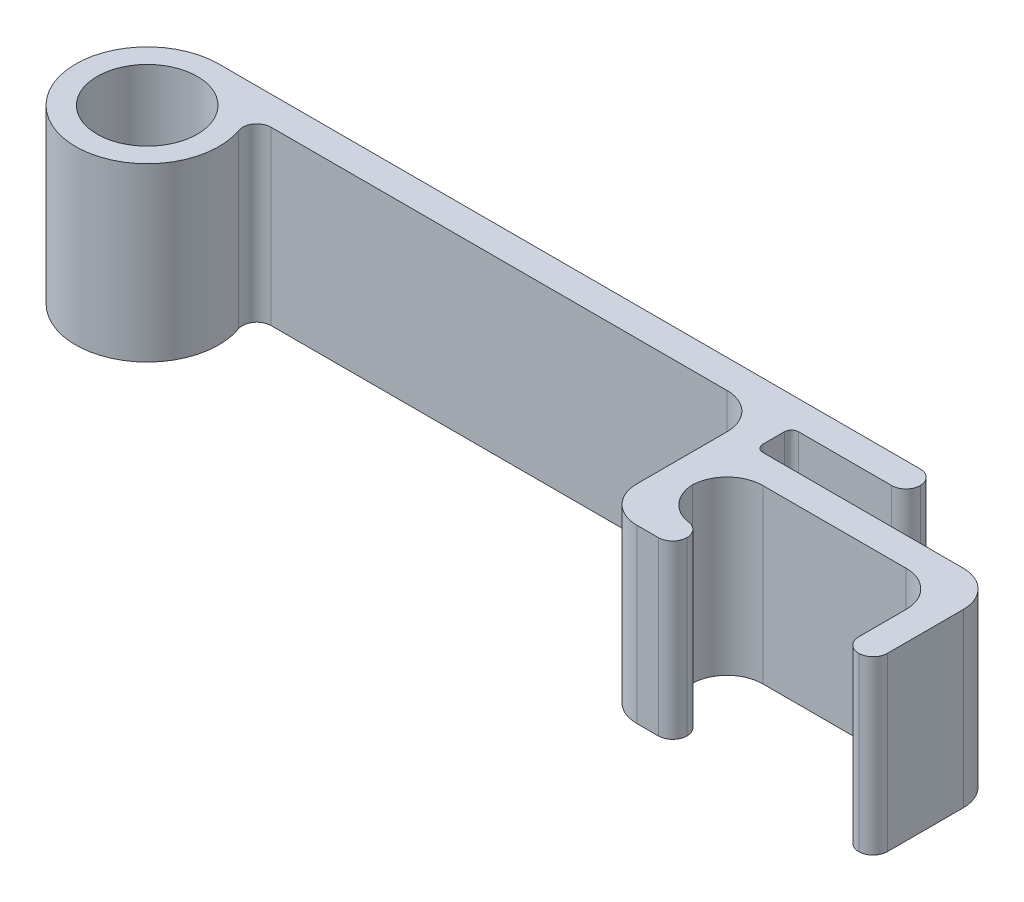
from build123d import *

# Parameters (mm, degrees)
SKETCH1_R           = 5
BOSS_EXTRUDE1_DEPTH = 12
SKETCH2_R           = 3.5
CUT_EXTRUDE1_DEPTH  = 14.928388277
BOSS_EXTRUDE2_START = -12
BOSS_EXTRUDE2_DEPTH = 12
BOSS_EXTRUDE3_DEPTH = 12
BOSS_EXTRUDE4_DEPTH = 12
FILLET1_R           = 1
FILLET2_R           = 2.5
FILLET3_R           = 2.5
FILLET4_R           = 1
FILLET5_R           = 0.5
SKETCH7_W           = 0.628205129
SKETCH7_H           = 3.58974359
CUT_EXTRUDE2_DEPTH  = 0.5


# Some blends are built 0.0001 mm under size
with BuildPart() as part:
    # Sketch1 → Boss-Extrude1 (new body)
    with BuildSketch(Plane(origin=(0, 0, 0), x_dir=(1, 0, 0), z_dir=(0, 1, 0))):
        with Locations(Location((0, 0, 0), (0, 0, 270))):
            Circle(SKETCH1_R)
    extrude(amount=BOSS_EXTRUDE1_DEPTH)

    # Sketch2 → Cut-Extrude1 (cut, through all)
    with BuildSketch(Plane(origin=(0, 12, 0), x_dir=(1, 0, 0), z_dir=(0, 1, 0))):
        with Locations(Location((0, 0, 0), (0, 0, 270))):
            Circle(SKETCH2_R)
    extrude(amount=-CUT_EXTRUDE1_DEPTH, mode=Mode.SUBTRACT)

    # Sketch3 → Boss-Extrude2 (add)
    with BuildSketch(Plane(origin=(0, 12, 0), x_dir=(1, 0, 0), z_dir=(0, 1, 0)).offset(BOSS_EXTRUDE2_START)):
        with BuildLine():
            Line((0, 5), (50, 5))
            Line((50, 5), (50, 3))
            Line((50, 3), (4, 3))
            ThreePointArc((4, 3), (2.236067977, 4.472135955), (0, 5))
        make_face()
    extrude(amount=BOSS_EXTRUDE2_DEPTH)

    # Sketch4 → Boss-Extrude3 (add)
    with BuildSketch(Plane(origin=(0, 12, 0), x_dir=(1, 0, 0), z_dir=(0, 1, 0))):
        Polygon((40, 3), (40, -8.3), (45, -8.3), (45, -6.3), (42, -6.3), (42, 3), align=None)
    extrude(amount=-BOSS_EXTRUDE3_DEPTH)

    # Sketch6 → Boss-Extrude4 (add)
    with BuildSketch(Plane(origin=(0, 12, 0), x_dir=(1, 0, 0), z_dir=(0, 1, 0))):
        Polygon((42, 0.5), (59, 0.5), (59, -1.5), (59, -8.3), (57, -8.3), (57, -1.5), (42, -1.5), align=None)
    extrude(amount=-BOSS_EXTRUDE4_DEPTH)

    # Fillet1
    fillet1_edges = [part.edges().sort_by_distance(p)[0] for p in [
        (59, 6, 8.3),
        (57, 6, 8.3),
        (45, 6, 8.3),
        (45, 6, 6.3),
        (50, 6, -5),
        (50, 6, -3),
    ]]
    fillet(fillet1_edges, radius=FILLET1_R - 0.0001)  # a hair under: the kernel refuses the full size

    # Fillet2
    # the kernel refuses this fillet: 2.5 mm, written as the material it adds along each edge
    with BuildSketch(Plane(origin=(57, 12, 1.5), x_dir=(0, 0, 1), z_dir=(0, -1, 0)), Plane(origin=(42, 12, 1.5), x_dir=(1, 0, 0), z_dir=(0, -1, 0))) as fillet2_piece_1:
        with BuildLine():
            CenterArc((FILLET2_R, FILLET2_R), FILLET2_R, 180, 90)
            Line((0, FILLET2_R), (0, 0))
            Line((0, 0), (FILLET2_R, 0))
        make_face()
    extrude(amount=12)
    with BuildSketch(Plane(origin=(42, 12, 6.3), x_dir=(0, 0, -1), z_dir=(0, -1, 0))) as fillet2_piece_2:
        with BuildLine():
            CenterArc((2.464115012, 2.5), FILLET2_R, 188.211792961, 81.788207039)
            Line((-0.010252121, 2.142918369), (-0.257688835, 2.107210206))
            ThreePointArc((-0.257688835, 2.107210206), (-0.25, 2.0001), (-0.25, 0))
            Line((-0.25, 0), (0, -0.25))
            Line((0, -0.25), (2.464115012, -0.25))
            Line((2.464115012, -0.25), (2.464115012, 0))
        make_face()
    extrude(amount=12)
    # the kernel refuses this fillet: 2.5 mm, written as the material it takes off along each edge
    with BuildSketch(Plane(origin=(59, 18.25, -0.5), x_dir=(-1, 0, 0), z_dir=(0, -1, 0)), Plane(origin=(40, 18.25, 8.3), x_dir=(1, 0, 0), z_dir=(0, -1, 0))) as fillet2_2_piece_1:
        with BuildLine():
            CenterArc((FILLET2_R, -FILLET2_R), FILLET2_R, 90, 90)
            Line((0, -FILLET2_R), (0, 0))
            Line((0, 0), (FILLET2_R, 0))
        make_face()
    extrude(amount=24.5, mode=Mode.SUBTRACT)

    # Fillet3
    fillet3_edges = [part.edges().sort_by_distance(p)[0] for p in [
        (40, 6, -3),
    ]]
    fillet(fillet3_edges, radius=FILLET3_R)

    # Fillet4
    fillet4_edges = [part.edges().sort_by_distance(p)[0] for p in [
        (4, 6, -3),
    ]]
    fillet(fillet4_edges, radius=FILLET4_R)

    # Fillet5
    fillet5_edges = [part.edges().sort_by_distance(p)[0] for p in [
        (42, 6, -3),
        (42, 6, -0.5),
    ]]
    fillet(fillet5_edges, radius=FILLET5_R)

    # Sketch7 → Cut-Extrude2 (cut)
    # profile 1 of 8: a face of its own
    with BuildSketch(Plane(origin=(0, 0, -5), x_dir=(-1, 0, 0), z_dir=(0, 0, -1))):
        Polygon((-34.160296283, 7.658316714), (-33.577664072, 7.658316714), (-32.164202533, 4.158316714), (-32.835176091, 4.158316714), (-33.107211347, 4.876265432), (-34.632151251, 4.876265432), (-34.904186507, 4.158316714), (-35.574458943, 4.158316714), align=None)
        Polygon((-33.869330738, 6.719514631), (-34.393769841, 5.50447056), (-33.344891636, 5.50447056), align=None, mode=Mode.SUBTRACT)
    # profile 2 of 8: a face of its own
    with BuildSketch(Plane(origin=(0, 0, -5), x_dir=(-1, 0, 0), z_dir=(0, 0, -1))):
        with Locations((-31.468689713, 5.953188509)):
            Rectangle(SKETCH7_W, SKETCH7_H)
    # profile 3 of 8: a face of its own
    with BuildSketch(Plane(origin=(0, 0, -5), x_dir=(-1, 0, 0), z_dir=(0, 0, -1))):
        with BuildLine():
            Line((-28.015664873, 5.280111586), (-30.032792277, 5.280111586))
            add(Edge.make_bspline(
                [(-30.032792277, 5.280111586), (-30.028679517, 5.25667371), (-30.020597619, 5.210616434), (-30.003047491, 5.143714245), (-29.980650895, 5.080666751), (-29.953809986, 5.021389673), (-29.9229773, 4.965569637), (-29.887013527, 4.91346846), (-29.846374833, 4.865132162), (-29.801296182, 4.820770818), (-29.752528952, 4.781022091), (-29.700309646, 4.746199694), (-29.644584378, 4.717647459), (-29.585992016, 4.693580887), (-29.524094741, 4.674517725), (-29.458801455, 4.661370224), (-29.390285242, 4.653603947), (-29.343609904, 4.652480644), (-29.319751411, 4.651906458)],
                knots=[0, 0, 0, 0, 1.091296461, 2.144483647, 3.168565212, 4.157007626, 5.126487748, 6.090021542, 7.05641414, 8.019231907, 8.98705074, 9.938580405, 10.892824166, 11.854447369, 12.841318655, 13.858982407, 14.905600794, 16, 16, 16, 16], degree=3))
            add(Edge.make_bspline(
                [(-29.319751411, 4.651906458), (-29.290952591, 4.652666775), (-29.234239233, 4.654164062), (-29.151153741, 4.667442778), (-29.070797967, 4.687499694), (-28.993932361, 4.717326013), (-28.919666554, 4.754454536), (-28.84922319, 4.800712108), (-28.78138295, 4.85474693), (-28.739992409, 4.89639695), (-28.718890033, 4.917631618)],
                knots=[0, 0, 0, 0, 1.021034703, 2.010718019, 2.977989445, 3.954245119, 4.929443971, 5.918328161, 6.938689359, 8, 8, 8, 8], degree=3))
            Line((-28.718890033, 4.917631618), (-28.193048687, 4.667331137))
            add(Edge.make_bspline(
                [(-28.193048687, 4.667331137), (-28.209604495, 4.644453552), (-28.242409219, 4.599122457), (-28.295961831, 4.5353299), (-28.351847392, 4.475808856), (-28.41010758, 4.420950804), (-28.470816285, 4.370912068), (-28.533804629, 4.325083087), (-28.599993162, 4.284694349), (-28.668058456, 4.247791872), (-28.739407546, 4.216155549), (-28.813842978, 4.18917721), (-28.891049475, 4.164789021), (-28.97200199, 4.146206557), (-29.056026432, 4.131496831), (-29.143323802, 4.121050976), (-29.233882597, 4.114599072), (-29.295434882, 4.113834206), (-29.326762629, 4.113444919)],
                knots=[0, 0, 0, 0, 1.028154879, 2.037251081, 3.030720504, 4.000128189, 4.949298328, 5.894184978, 6.834267904, 7.770992897, 8.712077017, 9.673380525, 10.653304757, 11.658697181, 12.695551717, 13.758623199, 14.859225354, 16, 16, 16, 16], degree=3))
            add(Edge.make_bspline(
                [(-29.326762629, 4.113444919), (-29.374959854, 4.114427516), (-29.469351341, 4.116351874), (-29.607415955, 4.134212675), (-29.738539044, 4.163827807), (-29.863090854, 4.204085031), (-29.98053299, 4.257237178), (-30.090923575, 4.322246663), (-30.195365567, 4.397867125), (-30.290667681, 4.485685634), (-30.377490719, 4.581270861), (-30.453750677, 4.683922867), (-30.517563924, 4.792924462), (-30.569968645, 4.907554251), (-30.610699416, 5.02810564), (-30.640063938, 5.154631237), (-30.658064743, 5.287070609), (-30.660008919, 5.377276605), (-30.660997405, 5.423140432)],
                knots=[0, 0, 0, 0, 1.103565453, 2.161269334, 3.182010356, 4.179077853, 5.15417608, 6.128274628, 7.109042802, 8.101804412, 9.090965879, 10.063106201, 11.02526161, 11.978650795, 12.945248442, 13.93468508, 14.949922959, 16, 16, 16, 16], degree=3))
            add(Edge.make_bspline(
                [(-30.660997405, 5.423140432), (-30.65999919, 5.470169718), (-30.658035247, 5.562697725), (-30.640218925, 5.698195183), (-30.610618233, 5.827478085), (-30.569768316, 5.950724467), (-30.51815858, 6.06831979), (-30.453533419, 6.179235237), (-30.377528562, 6.283856955), (-30.291018303, 6.381695513), (-30.19531246, 6.470005501), (-30.093615959, 6.548707348), (-29.984786137, 6.61428695), (-29.870053952, 6.667275229), (-29.750153273, 6.710326868), (-29.623698215, 6.738974138), (-29.491650909, 6.758209065), (-29.401386279, 6.759980481), (-29.355508623, 6.760880817)],
                knots=[0, 0, 0, 0, 1.079208495, 2.12329425, 3.130605359, 4.119693003, 5.099659317, 6.073216462, 7.060498243, 8.06384408, 9.066070512, 10.045757761, 11.010926815, 11.975797609, 12.942977511, 13.929384301, 14.947594487, 16, 16, 16, 16], degree=3))
            add(Edge.make_bspline(
                [(-29.355508623, 6.760880817), (-29.3070805, 6.759882976), (-29.211996873, 6.757923819), (-29.072970682, 6.740208044), (-28.940976952, 6.710412322), (-28.815453314, 6.670503195), (-28.698002758, 6.616008369), (-28.586044539, 6.552598664), (-28.482264049, 6.475343609), (-28.385555099, 6.387954855), (-28.298255507, 6.291000061), (-28.221945991, 6.18567746), (-28.157015985, 6.073014937), (-28.10438957, 5.952555624), (-28.063700623, 5.82466115), (-28.034308918, 5.689497612), (-28.016445417, 5.546550912), (-28.014537418, 5.448667114), (-28.013561507, 5.398601169)],
                knots=[0, 0, 0, 0, 1.080001299, 2.120471247, 3.119684163, 4.095710327, 5.052285597, 6.002875087, 6.961153713, 7.931888285, 8.906493152, 9.865905668, 10.82813294, 11.801621613, 12.7925306, 13.817193356, 14.883530496, 16, 16, 16, 16], degree=3))
            Line((-28.013561507, 5.398601169), (-28.015664873, 5.280111586))
        make_face()
        with BuildLine():
            add(Edge.make_bspline(
                [(-28.641766636, 5.77370133), (-28.653621251, 5.805692133), (-28.677191313, 5.869298185), (-28.730435104, 5.957059016), (-28.801087911, 6.03306346), (-28.883262194, 6.100350797), (-28.977151457, 6.154965403), (-29.079797087, 6.194508151), (-29.189901661, 6.218218479), (-29.265647674, 6.220999284), (-29.304326732, 6.222419278)],
                knots=[0, 0, 0, 0, 0.954238005, 1.897273737, 2.851915805, 3.847685534, 4.862635127, 5.880135777, 6.917509367, 8, 8, 8, 8], degree=3))
            add(Edge.make_bspline(
                [(-29.304326732, 6.222419278), (-29.34657056, 6.221055201), (-29.429148448, 6.218388713), (-29.54826143, 6.19002964), (-29.660617725, 6.147704571), (-29.726856629, 6.104066526), (-29.760055898, 6.082194919)],
                knots=[0, 0, 0, 0, 1.044195649, 2.041185066, 3.018232172, 4, 4, 4, 4], degree=3))
            add(Edge.make_bspline(
                [(-29.760055898, 6.082194919), (-29.780769763, 6.065537025), (-29.824930663, 6.030023246), (-29.882282552, 5.959176628), (-29.938774639, 5.873397277), (-29.970893505, 5.808241801), (-29.987920482, 5.77370133)],
                knots=[0, 0, 0, 0, 0.82159062, 1.751589201, 2.808063854, 4, 4, 4, 4], degree=3))
            Line((-29.987920482, 5.77370133), (-28.641766636, 5.77370133))
        make_face(mode=Mode.SUBTRACT)
    # profile 4 of 8: a face of its own
    with BuildSketch(Plane(origin=(0, 0, -5), x_dir=(-1, 0, 0), z_dir=(0, 0, -1))):
        Polygon((-27.660897245, 6.716009022), (-26.95206311, 6.716009022), (-26.446554296, 6.019093958), (-25.943148847, 6.716009022), (-25.234314713, 6.716009022), (-26.091085546, 5.529009823), (-25.096894841, 4.158316714), (-25.805728975, 4.158316714), (-26.44445093, 5.038925689), (-27.080368398, 4.158316714), (-27.789202533, 4.158316714), (-26.79991968, 5.529009823), align=None)
    # profile 5 of 8: a face of its own
    with BuildSketch(Plane(origin=(0, 0, -5), x_dir=(-1, 0, 0), z_dir=(0, 0, -1))):
        Polygon((-23.346894841, 7.658316714), (-21.641766636, 7.658316714), (-21.641766636, 7.030111586), (-22.718689713, 7.030111586), (-22.718689713, 6.357034663), (-21.641766636, 6.357034663), (-21.641766636, 5.728829535), (-22.718689713, 5.728829535), (-22.718689713, 4.158316714), (-23.346894841, 4.158316714), align=None)
    # profile 6 of 8: a face of its own
    with BuildSketch(Plane(origin=(0, 0, -5), x_dir=(-1, 0, 0), z_dir=(0, 0, -1))):
        with BuildLine():
            Line((-19.173817918, 6.716009022), (-18.545612789, 6.716009022))
            Line((-18.545612789, 6.716009022), (-18.545612789, 4.158316714))
            Line((-18.545612789, 4.158316714), (-19.173817918, 4.158316714))
            Line((-19.173817918, 4.158316714), (-19.173817918, 4.437363189))
            add(Edge.make_bspline(
                [(-19.173817918, 4.437363189), (-19.20494525, 4.410201103), (-19.265357256, 4.357484858), (-19.360547029, 4.28908419), (-19.456014957, 4.232662479), (-19.552219767, 4.187725664), (-19.650640085, 4.154544451), (-19.7519845, 4.130520477), (-19.857712478, 4.116352952), (-19.929584901, 4.114424361), (-19.966085546, 4.113444919)],
                knots=[0, 0, 0, 0, 1.129196829, 2.191548051, 3.199897424, 4.157751732, 5.089409408, 6.034969131, 7.002052659, 8, 8, 8, 8], degree=3))
            add(Edge.make_bspline(
                [(-19.966085546, 4.113444919), (-20.007059142, 4.114366697), (-20.08802529, 4.116188182), (-20.206834124, 4.135362252), (-20.321555864, 4.164712439), (-20.43209739, 4.206246622), (-20.538257579, 4.260066781), (-20.640848881, 4.324768672), (-20.738112566, 4.402623719), (-20.830858323, 4.490263333), (-20.915775782, 4.586667531), (-20.990011426, 4.690498238), (-21.052586557, 4.800282843), (-21.103851013, 4.91565736), (-21.144177128, 5.03653711), (-21.172923878, 5.163305488), (-21.189884493, 5.296007769), (-21.191983739, 5.386399366), (-21.193048687, 5.432255016)],
                knots=[0, 0, 0, 0, 0.980476535, 1.937477201, 2.874147792, 3.812856188, 4.758993464, 5.720109578, 6.712210464, 7.737600662, 8.772720504, 9.783789959, 10.789002326, 11.793715968, 12.802552247, 13.835794126, 14.902098527, 16, 16, 16, 16], degree=3))
            add(Edge.make_bspline(
                [(-21.193048687, 5.432255016), (-21.191931021, 5.479738601), (-21.189738593, 5.572882946), (-21.17370112, 5.709567843), (-21.145484856, 5.839479432), (-21.107009952, 5.962797661), (-21.057518669, 6.079543833), (-20.997241593, 6.189909217), (-20.925358711, 6.293605334), (-20.842526432, 6.388867204), (-20.753087916, 6.47617931), (-20.657404514, 6.552191422), (-20.556972507, 6.616767248), (-20.451685168, 6.669486181), (-20.341557532, 6.710224705), (-20.227024382, 6.740007893), (-20.10757727, 6.757878852), (-20.02620893, 6.759871852), (-19.985015834, 6.760880817)],
                knots=[0, 0, 0, 0, 1.136281865, 2.228943489, 3.287578264, 4.313574083, 5.316051562, 6.317280042, 7.318008486, 8.329309503, 9.333984563, 10.305318864, 11.248632312, 12.186624717, 13.117503092, 14.05354244, 15.014596925, 16, 16, 16, 16], degree=3))
            add(Edge.make_bspline(
                [(-19.985015834, 6.760880817), (-19.94685768, 6.760088073), (-19.871356447, 6.758519519), (-19.760380513, 6.741488026), (-19.652749864, 6.715729101), (-19.549051628, 6.67902727), (-19.44843524, 6.632683741), (-19.352631365, 6.574611846), (-19.259544206, 6.507252319), (-19.202746402, 6.454643102), (-19.173817918, 6.427847964)],
                knots=[0, 0, 0, 0, 1.017011718, 2.012299608, 2.98747302, 3.965332399, 4.941441765, 5.936729654, 6.94912688, 8, 8, 8, 8], degree=3))
            Line((-19.173817918, 6.427847964), (-19.173817918, 6.716009022))
        make_face()
        with BuildLine():
            add(Edge.make_bspline(
                [(-19.853204937, 6.177547484), (-19.878237059, 6.176779412), (-19.927298385, 6.175274041), (-19.999449779, 6.16621913), (-20.068404866, 6.150263974), (-20.133671866, 6.126693658), (-20.196223495, 6.097981578), (-20.255109899, 6.062020171), (-20.310817083, 6.019514552), (-20.363017429, 5.971493781), (-20.410605735, 5.918710174), (-20.451629632, 5.861111823), (-20.486493317, 5.800250675), (-20.515978934, 5.735943743), (-20.537083946, 5.667430076), (-20.553799106, 5.595601601), (-20.562473192, 5.519871515), (-20.564045531, 5.468263805), (-20.564843559, 5.442070721)],
                knots=[0, 0, 0, 0, 1.04836806, 2.054732945, 3.03993516, 4.00574415, 4.955904794, 5.917688631, 6.888591924, 7.88601754, 8.884115178, 9.859153345, 10.841239365, 11.818093293, 12.814750328, 13.83810466, 14.90274714, 16, 16, 16, 16], degree=3))
            add(Edge.make_bspline(
                [(-20.564843559, 5.442070721), (-20.564057721, 5.41564005), (-20.562509237, 5.36355872), (-20.553658855, 5.287189823), (-20.537545175, 5.214312103), (-20.514035923, 5.145514724), (-20.485325673, 5.079869384), (-20.450378843, 5.017679041), (-20.407452783, 4.960043299), (-20.359822761, 4.905598302), (-20.306551533, 4.856981032), (-20.250529135, 4.813813361), (-20.190990345, 4.777694998), (-20.128581116, 4.748503908), (-20.063511521, 4.724715624), (-19.994965784, 4.708960992), (-19.923615397, 4.698889353), (-19.874973954, 4.697486812), (-19.85040045, 4.696778253)],
                knots=[0, 0, 0, 0, 1.099136573, 2.165835871, 3.191374663, 4.196217796, 5.183857741, 6.167377911, 7.154730987, 8.166690795, 9.170734848, 10.148332609, 11.103258353, 12.059567475, 13.009337315, 13.978056681, 14.978520572, 16, 16, 16, 16], degree=3))
            add(Edge.make_bspline(
                [(-19.85040045, 4.696778253), (-19.824902075, 4.697550631), (-19.774911398, 4.699064911), (-19.701582891, 4.708037186), (-19.631701489, 4.724050843), (-19.565557937, 4.747756105), (-19.502141954, 4.776262089), (-19.442025812, 4.811520782), (-19.385861863, 4.853928863), (-19.333365663, 4.902383743), (-19.285263014, 4.955598359), (-19.243671789, 5.013952022), (-19.20744431, 5.075578419), (-19.178953064, 5.141934625), (-19.15632702, 5.211859714), (-19.140093355, 5.285787658), (-19.131263183, 5.363798159), (-19.129728241, 5.417043366), (-19.128946123, 5.444174086)],
                knots=[0, 0, 0, 0, 1.050008698, 2.058587853, 3.036635738, 3.995319155, 4.947022481, 5.895997462, 6.858296291, 7.838991643, 8.833936038, 9.806048392, 10.784806122, 11.771666913, 12.772873988, 13.80724452, 14.882696879, 16, 16, 16, 16], degree=3))
            add(Edge.make_bspline(
                [(-19.128946123, 5.444174086), (-19.129718523, 5.470838171), (-19.131227244, 5.522920874), (-19.140131437, 5.599302553), (-19.156480352, 5.671778889), (-19.178640715, 5.740483105), (-19.207638828, 5.805258107), (-19.243893718, 5.865385697), (-19.285028712, 5.922949069), (-19.333663926, 5.974726065), (-19.385875743, 6.022830094), (-19.442865674, 6.063955723), (-19.502838226, 6.099398932), (-19.566161872, 6.128499173), (-19.63342296, 6.149830752), (-19.703423785, 6.166347014), (-19.777256503, 6.175268606), (-19.827475662, 6.176775462), (-19.853204937, 6.177547484)],
                knots=[0, 0, 0, 0, 1.106611376, 2.161533483, 3.185006901, 4.184773755, 5.152708835, 6.122342771, 7.094156588, 8.082475533, 9.064254463, 10.03606828, 10.992420271, 11.951521816, 12.920622147, 13.915721683, 14.932141191, 16, 16, 16, 16], degree=3))
        make_face(mode=Mode.SUBTRACT)
    # profile 7 of 8: a face of its own
    with BuildSketch(Plane(origin=(0, 0, -5), x_dir=(-1, 0, 0), z_dir=(0, 0, -1))):
        with BuildLine():
            Line((-18.007151251, 6.716009022), (-17.468689713, 6.716009022))
            Line((-17.468689713, 6.716009022), (-17.468689713, 6.401205336))
            add(Edge.make_bspline(
                [(-17.468689713, 6.401205336), (-17.453457669, 6.429182026), (-17.423686009, 6.483863628), (-17.368992972, 6.557262849), (-17.306159396, 6.619077626), (-17.237443085, 6.670600869), (-17.162635774, 6.710758179), (-17.08374067, 6.739375324), (-17.001432719, 6.757972503), (-16.945285024, 6.759904399), (-16.91690686, 6.760880817)],
                knots=[0, 0, 0, 0, 1.09866127, 2.147379032, 3.14564304, 4.131443017, 5.102343063, 6.064490016, 7.021754664, 8, 8, 8, 8], degree=3))
            add(Edge.make_bspline(
                [(-16.91690686, 6.760880817), (-16.896300772, 6.759915912), (-16.854339418, 6.75795102), (-16.79038441, 6.746529074), (-16.725506644, 6.725876023), (-16.682811484, 6.707280696), (-16.660997405, 6.697779855)],
                knots=[0, 0, 0, 0, 0.931404136, 1.896671404, 2.925354185, 4, 4, 4, 4], degree=3))
            Line((-16.660997405, 6.697779855), (-16.855909264, 6.165628413))
            add(Edge.make_bspline(
                [(-16.855909264, 6.165628413), (-16.873331601, 6.174046044), (-16.906078887, 6.189867949), (-16.953622261, 6.208539428), (-16.996769844, 6.219931851), (-17.02412462, 6.221631701), (-17.036798687, 6.222419278)],
                knots=[0, 0, 0, 0, 1.214386998, 2.282580073, 3.20428172, 4, 4, 4, 4], degree=3))
            add(Edge.make_bspline(
                [(-17.036798687, 6.222419278), (-17.048765471, 6.221897388), (-17.072306197, 6.22087074), (-17.107051649, 6.212072711), (-17.13977463, 6.196900784), (-17.172052058, 6.177464039), (-17.201337602, 6.15044551), (-17.230605057, 6.119166765), (-17.256397105, 6.080548995), (-17.283615196, 6.037565455), (-17.306790427, 5.984953641), (-17.326662475, 5.922145977), (-17.344368628, 5.848415736), (-17.356552879, 5.763371445), (-17.368329447, 5.667836055), (-17.37533915, 5.561108348), (-17.38056357, 5.443525808), (-17.380883008, 5.361448951), (-17.381049488, 5.318673285)],
                knots=[0, 0, 0, 0, 0.544232178, 1.070598461, 1.618251235, 2.182094276, 2.777567932, 3.425210017, 4.127676488, 4.886675562, 5.738955394, 6.734782583, 7.883056018, 9.186093582, 10.642914445, 12.264202625, 14.053029461, 16, 16, 16, 16], degree=3))
            Line((-17.381049488, 5.318673285), (-17.378946123, 5.193873605))
            Line((-17.378946123, 5.193873605), (-17.378946123, 4.158316714))
            Line((-17.378946123, 4.158316714), (-18.007151251, 4.158316714))
            Line((-18.007151251, 4.158316714), (-18.007151251, 6.716009022))
        make_face()
    # profile 8 of 8: a face of its own
    with BuildSketch(Plane(origin=(0, 0, -5), x_dir=(-1, 0, 0), z_dir=(0, 0, -1))):
        with BuildLine():
            Line((-13.791305898, 5.280111586), (-15.808433302, 5.280111586))
            add(Edge.make_bspline(
                [(-15.808433302, 5.280111586), (-15.804320542, 5.25667371), (-15.796238645, 5.210616434), (-15.778688517, 5.143714245), (-15.756291921, 5.080666751), (-15.729451012, 5.021389673), (-15.698618326, 4.965569637), (-15.662654552, 4.91346846), (-15.622015859, 4.865132162), (-15.576937208, 4.820770818), (-15.528169978, 4.781022091), (-15.475950672, 4.746199694), (-15.420225403, 4.717647459), (-15.361633041, 4.693580887), (-15.299735766, 4.674517725), (-15.234442481, 4.661370224), (-15.165926267, 4.653603947), (-15.11925093, 4.652480644), (-15.095392437, 4.651906458)],
                knots=[0, 0, 0, 0, 1.091296461, 2.144483647, 3.168565212, 4.157007626, 5.126487748, 6.090021542, 7.05641414, 8.019231907, 8.98705074, 9.938580405, 10.892824166, 11.854447369, 12.841318655, 13.858982407, 14.905600794, 16, 16, 16, 16], degree=3))
            add(Edge.make_bspline(
                [(-15.095392437, 4.651906458), (-15.066593617, 4.652666775), (-15.009880258, 4.654164062), (-14.926794766, 4.667442778), (-14.846438993, 4.687499694), (-14.769573386, 4.717326013), (-14.69530758, 4.754454536), (-14.624864216, 4.800712108), (-14.557023976, 4.85474693), (-14.515633435, 4.89639695), (-14.494531059, 4.917631618)],
                knots=[0, 0, 0, 0, 1.021034703, 2.010718019, 2.977989445, 3.954245119, 4.929443971, 5.918328161, 6.938689359, 8, 8, 8, 8], degree=3))
            Line((-14.494531059, 4.917631618), (-13.968689713, 4.667331137))
            add(Edge.make_bspline(
                [(-13.968689713, 4.667331137), (-13.98524552, 4.644453552), (-14.018050245, 4.599122457), (-14.071602857, 4.5353299), (-14.127488417, 4.475808856), (-14.185748606, 4.420950804), (-14.246457311, 4.370912068), (-14.309445655, 4.325083087), (-14.375634188, 4.284694349), (-14.443699482, 4.247791872), (-14.515048572, 4.216155549), (-14.589484003, 4.18917721), (-14.666690501, 4.164789021), (-14.747643016, 4.146206557), (-14.831667457, 4.131496831), (-14.918964828, 4.121050976), (-15.009523622, 4.114599072), (-15.071075907, 4.113834206), (-15.102403655, 4.113444919)],
                knots=[0, 0, 0, 0, 1.028154879, 2.037251081, 3.030720504, 4.000128189, 4.949298328, 5.894184978, 6.834267904, 7.770992897, 8.712077017, 9.673380525, 10.653304757, 11.658697181, 12.695551717, 13.758623199, 14.859225354, 16, 16, 16, 16], degree=3))
            add(Edge.make_bspline(
                [(-15.102403655, 4.113444919), (-15.15060088, 4.114427516), (-15.244992367, 4.116351874), (-15.38305698, 4.134212675), (-15.514180069, 4.163827807), (-15.63873188, 4.204085031), (-15.756174016, 4.257237178), (-15.8665646, 4.322246663), (-15.971006592, 4.397867125), (-16.066308707, 4.485685634), (-16.153131744, 4.581270861), (-16.229391702, 4.683922867), (-16.293204949, 4.792924462), (-16.345609671, 4.907554251), (-16.386340441, 5.02810564), (-16.415704964, 5.154631237), (-16.433705768, 5.287070609), (-16.435649944, 5.377276605), (-16.43663843, 5.423140432)],
                knots=[0, 0, 0, 0, 1.103565453, 2.161269334, 3.182010356, 4.179077853, 5.15417608, 6.128274628, 7.109042802, 8.101804412, 9.090965879, 10.063106201, 11.02526161, 11.978650795, 12.945248442, 13.93468508, 14.949922959, 16, 16, 16, 16], degree=3))
            add(Edge.make_bspline(
                [(-16.43663843, 5.423140432), (-16.435640216, 5.470169718), (-16.433676273, 5.562697725), (-16.415859951, 5.698195183), (-16.386259258, 5.827478085), (-16.345409342, 5.950724467), (-16.293799606, 6.06831979), (-16.229174445, 6.179235237), (-16.153169588, 6.283856955), (-16.066659329, 6.381695513), (-15.970953485, 6.470005501), (-15.869256985, 6.548707348), (-15.760427162, 6.61428695), (-15.645694978, 6.667275229), (-15.525794298, 6.710326868), (-15.399339241, 6.738974138), (-15.267291935, 6.758209065), (-15.177027304, 6.759980481), (-15.131149648, 6.760880817)],
                knots=[0, 0, 0, 0, 1.079208495, 2.12329425, 3.130605359, 4.119693003, 5.099659317, 6.073216462, 7.060498243, 8.06384408, 9.066070512, 10.045757761, 11.010926815, 11.975797609, 12.942977511, 13.929384301, 14.947594487, 16, 16, 16, 16], degree=3))
            add(Edge.make_bspline(
                [(-15.131149648, 6.760880817), (-15.082721526, 6.759882976), (-14.987637899, 6.757923819), (-14.848611708, 6.740208044), (-14.716617978, 6.710412322), (-14.59109434, 6.670503195), (-14.473643784, 6.616008369), (-14.361685565, 6.552598664), (-14.257905075, 6.475343609), (-14.161196125, 6.387954855), (-14.073896533, 6.291000061), (-13.997587017, 6.18567746), (-13.932657011, 6.073014937), (-13.880030596, 5.952555624), (-13.839341649, 5.82466115), (-13.809949944, 5.689497612), (-13.792086443, 5.546550912), (-13.790178443, 5.448667114), (-13.789202533, 5.398601169)],
                knots=[0, 0, 0, 0, 1.080001299, 2.120471247, 3.119684163, 4.095710327, 5.052285597, 6.002875087, 6.961153713, 7.931888285, 8.906493152, 9.865905668, 10.82813294, 11.801621613, 12.7925306, 13.817193356, 14.883530496, 16, 16, 16, 16], degree=3))
            Line((-13.789202533, 5.398601169), (-13.791305898, 5.280111586))
        make_face()
        with BuildLine():
            add(Edge.make_bspline(
                [(-14.417407661, 5.77370133), (-14.429262276, 5.805692133), (-14.452832339, 5.869298185), (-14.50607613, 5.957059016), (-14.576728936, 6.03306346), (-14.658903219, 6.100350797), (-14.752792483, 6.154965403), (-14.855438112, 6.194508151), (-14.965542686, 6.218218479), (-15.0412887, 6.220999284), (-15.079967757, 6.222419278)],
                knots=[0, 0, 0, 0, 0.954238005, 1.897273737, 2.851915805, 3.847685534, 4.862635127, 5.880135777, 6.917509367, 8, 8, 8, 8], degree=3))
            add(Edge.make_bspline(
                [(-15.079967757, 6.222419278), (-15.122211586, 6.221055201), (-15.204789474, 6.218388713), (-15.323902456, 6.19002964), (-15.436258751, 6.147704571), (-15.502497655, 6.104066526), (-15.535696924, 6.082194919)],
                knots=[0, 0, 0, 0, 1.044195649, 2.041185066, 3.018232172, 4, 4, 4, 4], degree=3))
            add(Edge.make_bspline(
                [(-15.535696924, 6.082194919), (-15.556410789, 6.065537025), (-15.600571689, 6.030023246), (-15.657923577, 5.959176628), (-15.714415665, 5.873397277), (-15.746534531, 5.808241801), (-15.763561507, 5.77370133)],
                knots=[0, 0, 0, 0, 0.82159062, 1.751589201, 2.808063854, 4, 4, 4, 4], degree=3))
            Line((-15.763561507, 5.77370133), (-14.417407661, 5.77370133))
        make_face(mode=Mode.SUBTRACT)
    extrude(amount=-CUT_EXTRUDE2_DEPTH, mode=Mode.SUBTRACT)


solid = part.part
